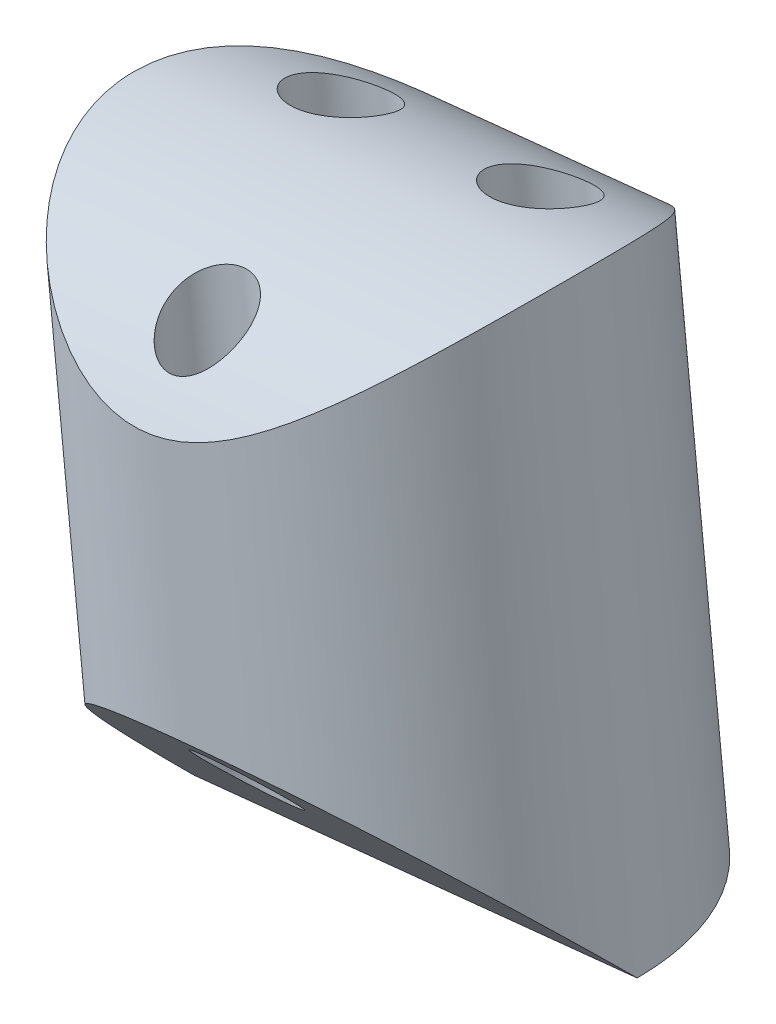
from build123d import *

# Parameters (mm, degrees)
SKETCH3_R               = 8
BOSS_EXTRUDE1_DEPTH     = 21.052631579
CUT_EXTRUDE1_DEPTH      = 220.648426525
CUT_EXTRUDE1_DEPTH_BACK = 220.648426525
CUT_EXTRUDE2_DEPTH      = 220.520875901
CUT_EXTRUDE2_DEPTH_BACK = 220.520875901
CUT_EXTRUDE3_DEPTH      = 26.304811832
CUT_EXTRUDE3_DEPTH_BACK = 26.304811832
SKETCH8_R               = 1.6
SKETCH8_R_2             = 1.4


with BuildPart() as part:
    # Sketch3 → Boss-Extrude1 (new body)
    with BuildSketch(Plane(origin=(-12.082314344, 217.636022384, 0), x_dir=(-0.9946657577296572, -0.10315052302381673, 0), z_dir=(0.10315052302381673, -0.9946657577296572, 0))):
        Circle(SKETCH3_R)
    extrude(amount=BOSS_EXTRUDE1_DEPTH)

    # Sketch4 → Cut-Extrude1 (cut, two sides: drawn at the far end of the back side and taken through both)
    with BuildSketch(Plane(origin=(10.375761543, 1.076004901, 0), x_dir=(0.10315052302381672, -0.9946657577296572, 0), z_dir=(-0.9946657577296572, -0.10315052302381673, 0)).offset(-CUT_EXTRUDE1_DEPTH_BACK)):
        with BuildLine():
            Line((-217.721396158, 8), (-213.721396158, 8))
            ThreePointArc((-213.721396158, 8), (-217.59367935, 0), (-213.721396158, -8))
            Line((-213.721396158, -8), (-217.721396158, -8))
            Line((-217.721396158, -8), (-217.721396158, 8))
        make_face()
    extrude(amount=CUT_EXTRUDE1_DEPTH + CUT_EXTRUDE1_DEPTH_BACK, mode=Mode.SUBTRACT)

    # Sketch5 → Cut-Extrude2 (cut, two sides: drawn at the far end of the back side and taken through both)
    with BuildSketch(Plane(origin=(10.375761543, 1.076004901, 0), x_dir=(0.10315052302381672, -0.9946657577296572, 0), z_dir=(-0.9946657577296572, -0.10315052302381673, 0)).offset(-CUT_EXTRUDE2_DEPTH_BACK)):
        Polygon((-196.668764579, 0), (-204.668764579, 8), (-196.668764579, 8), align=None)
    extrude(amount=CUT_EXTRUDE2_DEPTH + CUT_EXTRUDE2_DEPTH_BACK, mode=Mode.SUBTRACT)

    # Sketch8 → Cut-Extrude3 (cut, two sides: drawn at the far end of the back side and taken through both)
    with BuildSketch(Plane(origin=(-12.082314344, 217.636022384, 0), x_dir=(-0.9946657577296572, -0.10315052302381673, 0), z_dir=(0.10315052302381673, -0.9946657577296572, 0)).offset(-CUT_EXTRUDE3_DEPTH_BACK)):
        with Locations((-3.6, 3)):
            Circle(SKETCH8_R)
        with Locations((3.6, 3)):
            Circle(SKETCH8_R)
        with Locations((0, -5.5)):
            Circle(SKETCH8_R_2)
    extrude(amount=CUT_EXTRUDE3_DEPTH + CUT_EXTRUDE3_DEPTH_BACK, mode=Mode.SUBTRACT)


solid = part.part
